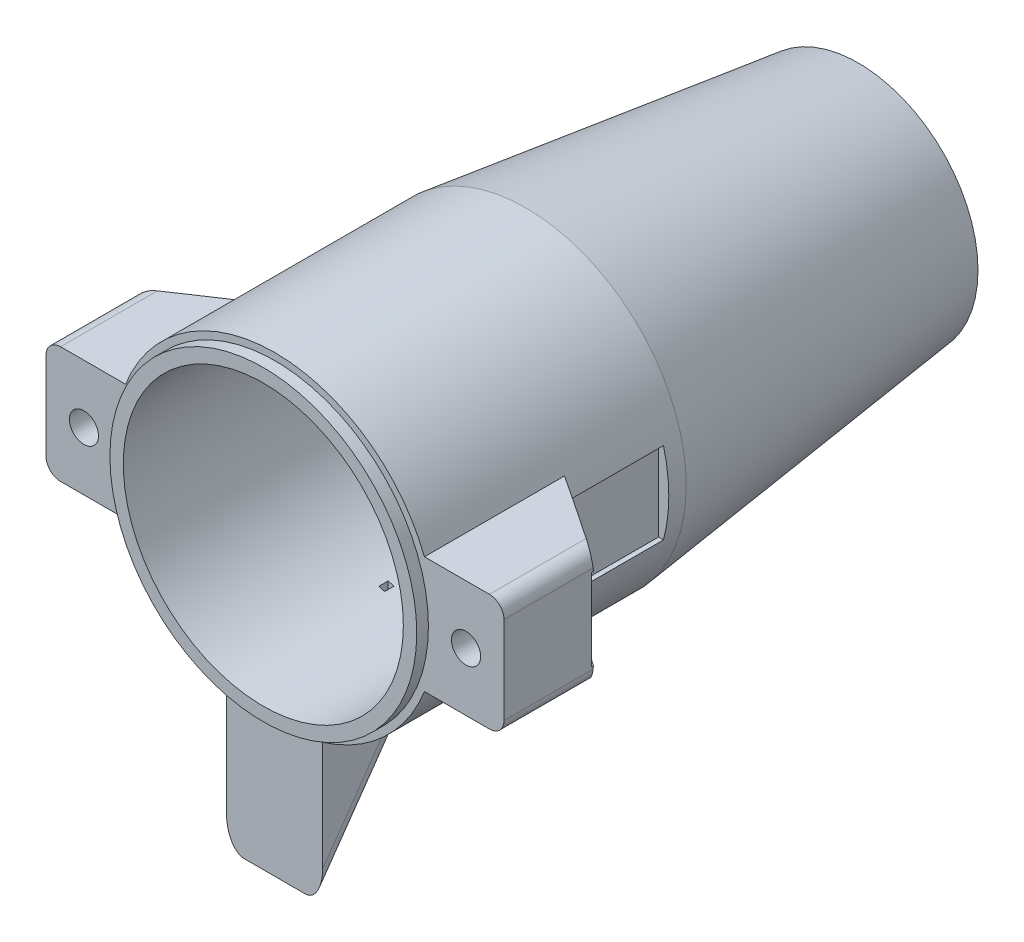
from build123d import *

# Parameters (mm, degrees)
SKETCH1_R               = 13.75
SKETCH1_R_2             = 12
BOSS_EXTRUDE1_DEPTH     = 50
SKETCH2_R               = 1.25
BOSS_EXTRUDE2_DEPTH     = 7.5
SKETCH4_R               = 13.25
BOSS_EXTRUDE3_DEPTH     = 20
SKETCH8_R               = 5.2
CUT_EXTRUDE2_DEPTH      = 20
CHAMFER2_SIZE           = 2.8
CHAMFER2_SIZE2          = 19.311263845
BOSS_EXTRUDE4_DEPTH     = 0.991311543
SKETCH9_W               = 6.2
SKETCH9_H               = 6.2
CUT_EXTRUDE3_DEPTH      = 1.2
CUT_EXTRUDE4_REACH      = 62.367
CUT_EXTRUDE4_END_RADIUS = 12
SKETCH10_W              = 0.5
SKETCH10_H              = 0.8
BOSS_EXTRUDE5_START     = 1
SKETCH11_R              = 13.15
SKETCH11_R_2            = 12
BOSS_EXTRUDE5_DEPTH     = 1
CHAMFER4_SIZE           = 1
SKETCH12_W              = 8.25
SKETCH12_H              = 12
BOSS_EXTRUDE6_DEPTH     = 8.5
CHAMFER5_SIZE           = 8.5
CHAMFER5_SIZE_2         = 12.139258057
FILLET3_R               = 1.5
SKETCH13_W              = 7
SKETCH13_H              = 7
CUT_EXTRUDE5_DEPTH      = 12.5
CHAMFER6_SIZE           = 4.5
CHAMFER6_SIZE_2         = 6.42666603
CHAMFER3_SIZE           = 3.5
CHAMFER3_SIZE2          = 28.505212498
FILLET4_R               = 1.25


with BuildPart() as part:
    # Sketch1 → Boss-Extrude1 (new body)
    with BuildSketch(Plane.XY):
        Circle(SKETCH1_R)
        Circle(SKETCH1_R_2, mode=Mode.SUBTRACT)
    extrude(amount=-BOSS_EXTRUDE1_DEPTH)

    # Sketch2 → Boss-Extrude2 (add)
    # profile 1 of 2: a face of its own
    with BuildSketch(Plane.XY):
        with BuildLine():
            ThreePointArc((-12.808688457, -5), (-13.75, 0), (-12.808688457, 5))
            Line((-12.808688457, 5), (-19.624999957, 5))
            Line((-19.624999957, 5), (-19.624999957, -5))
            Line((-19.624999957, -5), (-12.808688457, -5))
        make_face()
        with Locations((-16.375, 0)):
            Circle(SKETCH2_R, mode=Mode.SUBTRACT)
    # profile 2 of 2: a face of its own
    with BuildSketch(Plane.XY):
        with BuildLine():
            Line((19.624999957, 5), (12.808688457, 5))
            ThreePointArc((12.808688457, 5), (13.512623104, 2.54391762), (13.75, 0))
            ThreePointArc((13.75, 0), (13.512623104, -2.54391762), (12.808688457, -5))
            Line((12.808688457, -5), (19.624999957, -5))
            Line((19.624999957, -5), (19.624999957, 5))
        make_face()
        with Locations((16.375, 0)):
            Circle(SKETCH2_R, mode=Mode.SUBTRACT)
    extrude(amount=-BOSS_EXTRUDE2_DEPTH)

    # Sketch4 → Boss-Extrude3 (add)
    with BuildSketch(Plane(origin=(0, 0, -50), x_dir=(-1, 0, 0), z_dir=(0, 0, -1))):
        Circle(SKETCH4_R)
    extrude(amount=-BOSS_EXTRUDE3_DEPTH)

    # Sketch8 → Cut-Extrude2 (cut)
    with BuildSketch(Plane.XY.offset(-30)):
        Circle(SKETCH8_R)
    extrude(amount=-CUT_EXTRUDE2_DEPTH, mode=Mode.SUBTRACT)

    # Chamfer2
    chamfer2_edges = [part.edges().sort_by_distance(p)[0] for p in [
        (-5.2, 0, -30),
    ]]
    chamfer2_side = [part.faces().sort_by_distance(p)[0] for p in [
        (-11.660588745, 0, -30),
    ]]
    chamfer(chamfer2_edges, length=CHAMFER2_SIZE, length2=CHAMFER2_SIZE2, reference=chamfer2_side[0])

    # 3DSketch3 → Boss-Extrude4 (add)
    with BuildSketch(Plane(origin=(-5, -13.8, -11), x_dir=(0.7808688094430304, 0, -0.6246950475544243), z_dir=(0, -1, 0))):
        Polygon((0, 0), (7.808688094, 6.246950476), (12.806248475, 0), (4.99756038, -6.246950476), align=None)
    extrude(amount=-BOSS_EXTRUDE4_DEPTH)

    # Sketch9 → Cut-Extrude3 (cut)
    with BuildSketch(Plane.XZ.offset(13.8)):
        with Locations((0, -15)):
            Rectangle(SKETCH9_W, SKETCH9_H)
    extrude(amount=-CUT_EXTRUDE3_DEPTH, mode=Mode.SUBTRACT)

    # Cut-Extrude4: up to this cylinder (the profile starts outside it)
    cut_extrude4_end = Plane(origin=(0, 0, -15), z_dir=(0, 0, 1)) * Cylinder(CUT_EXTRUDE4_END_RADIUS, 154.234, mode=Mode.PRIVATE)
    # Sketch10 → Cut-Extrude4 (cut, up to the surface)
    with BuildSketch(Plane.XZ.offset(13.8), mode=Mode.PRIVATE) as cut_extrude4_sk1:
        with Locations((3.2, -12.75)):
            Rectangle(SKETCH10_W, SKETCH10_H)
    cut_extrude4_tool1 = extrude(cut_extrude4_sk1.sketch, amount=-CUT_EXTRUDE4_REACH, mode=Mode.PRIVATE) - cut_extrude4_end
    add(cut_extrude4_tool1.solids().sort_by_distance((3.2, -13.8, -12.75))[0], mode=Mode.SUBTRACT)
    # Sketch10 → Cut-Extrude4 (cut, up to the surface)
    with BuildSketch(Plane.XZ.offset(13.8), mode=Mode.PRIVATE) as cut_extrude4_sk2:
        with Locations((-3.2, -12.75)):
            Rectangle(SKETCH10_W, SKETCH10_H)
    cut_extrude4_tool2 = extrude(cut_extrude4_sk2.sketch, amount=-CUT_EXTRUDE4_REACH, mode=Mode.PRIVATE) - cut_extrude4_end
    add(cut_extrude4_tool2.solids().sort_by_distance((-3.2, -13.8, -12.75))[0], mode=Mode.SUBTRACT)
    # Sketch10 → Cut-Extrude4 (cut, up to the surface)
    with BuildSketch(Plane.XZ.offset(13.8), mode=Mode.PRIVATE) as cut_extrude4_sk3:
        with Locations((3.2, -17.25)):
            Rectangle(SKETCH10_W, SKETCH10_H)
    cut_extrude4_tool3 = extrude(cut_extrude4_sk3.sketch, amount=-CUT_EXTRUDE4_REACH, mode=Mode.PRIVATE) - cut_extrude4_end
    add(cut_extrude4_tool3.solids().sort_by_distance((3.2, -13.8, -17.25))[0], mode=Mode.SUBTRACT)
    # Sketch10 → Cut-Extrude4 (cut, up to the surface)
    with BuildSketch(Plane.XZ.offset(13.8), mode=Mode.PRIVATE) as cut_extrude4_sk4:
        with Locations((-3.2, -17.25)):
            Rectangle(SKETCH10_W, SKETCH10_H)
    cut_extrude4_tool4 = extrude(cut_extrude4_sk4.sketch, amount=-CUT_EXTRUDE4_REACH, mode=Mode.PRIVATE) - cut_extrude4_end
    add(cut_extrude4_tool4.solids().sort_by_distance((-3.2, -13.8, -17.25))[0], mode=Mode.SUBTRACT)

    # Sketch11 → Boss-Extrude5 (add)
    with BuildSketch(Plane.XY.offset(BOSS_EXTRUDE5_START)):
        Circle(SKETCH11_R)
        Circle(SKETCH11_R_2, mode=Mode.SUBTRACT)
    extrude(amount=-BOSS_EXTRUDE5_DEPTH)

    # Chamfer4
    # the kernel refuses this chamfer: 1 mm, written as the material it takes off along each edge
    with BuildSketch(Plane(origin=(-5, -13.8, -21.571682988), x_dir=(0.9996219169112968, -0.027495876610585647, 0), z_dir=(0, 0, 1))) as chamfer4_piece_1_section:
        Polygon((CHAMFER4_SIZE * 0.999621916911, CHAMFER4_SIZE * 0.0274958766106), (-CHAMFER4_SIZE * 0.0274958766106, CHAMFER4_SIZE * 0.999621916911), (0, 0), align=None)
    chamfer4_piece_1 = extrude(amount=13.143365976, mode=Mode.PRIVATE)
    chamfer4_piece_1 = chamfer4_piece_1 - Plane(origin=(0, 0, -15), x_dir=(1, 0, 0), z_dir=(0, 0, 1)) * Cylinder(13.75, 31, mode=Mode.PRIVATE)
    add(chamfer4_piece_1, mode=Mode.SUBTRACT)
    with BuildSketch(Plane(origin=(5, -13.8, -8.428317012), x_dir=(0.02749587661058651, 0.9996219169112968, 0), z_dir=(0, 0, -1))) as chamfer4_piece_2_section:
        Polygon((CHAMFER4_SIZE * 0.999621916911, -CHAMFER4_SIZE * 0.0274958766106), (-CHAMFER4_SIZE * 0.0274958766106, -CHAMFER4_SIZE * 0.999621916911), (0, 0), align=None)
    chamfer4_piece_2 = extrude(amount=13.143365976, mode=Mode.PRIVATE)
    chamfer4_piece_2 = chamfer4_piece_2 - Plane(origin=(0, 0, -15), x_dir=(1, 0, 0), z_dir=(0, 0, 1)) * Cylinder(13.75, 31, mode=Mode.PRIVATE)
    add(chamfer4_piece_2, mode=Mode.SUBTRACT)

    # Sketch12 → Boss-Extrude6 (add)
    with BuildSketch(Plane.XY):
        with Locations((-0.036830357, -19.128189859)):
            Rectangle(SKETCH12_W, SKETCH12_H)
    extrude(amount=-BOSS_EXTRUDE6_DEPTH)

    # Chamfer5
    # the kernel refuses this chamfer: 12.139258057, 8.5 mm, written as the material it takes off along each edge
    with BuildSketch(Plane(origin=(-35.512098327, -25.128189859, -8.5), x_dir=(0, -0.045263737714021236, 0.9989750717851554), z_dir=(1, 0, 0))) as chamfer5_piece_1_section:
        Polygon((CHAMFER5_SIZE * 0.998975071785, -CHAMFER5_SIZE * 0.045263737714), (-CHAMFER5_SIZE_2 * 0.0452637377152, -CHAMFER5_SIZE_2 * 0.998975071811), (0, 0), align=None)
    chamfer5_piece_1 = extrude(amount=70.95053594, mode=Mode.PRIVATE)
    chamfer5_piece_1 = chamfer5_piece_1 - Plane(origin=(0, 0, -5.73810834), x_dir=(1, 0, 0), z_dir=(0, 0, 1)) * Cylinder(13.75, 191, mode=Mode.PRIVATE)
    add(chamfer5_piece_1, mode=Mode.SUBTRACT)

    # Fillet3
    fillet3_edges = [part.edges().sort_by_distance(p)[0] for p in [
        (-4.161830357, -19.128189859, -4.201245229),
        (4.088169643, -19.128189859, -4.201245229),
    ]]
    fillet(fillet3_edges, radius=FILLET3_R)

    # Sketch13 → Cut-Extrude5 (cut)
    with BuildSketch(Plane(origin=(0, 0, -7.5), x_dir=(-1, 0, 0), z_dir=(0, 0, -1))):
        with Locations((-16.375, 0)):
            Rectangle(SKETCH13_W, SKETCH13_H)
        with Locations((16.375, 0)):
            Rectangle(SKETCH13_W, SKETCH13_H)
    extrude(amount=CUT_EXTRUDE5_DEPTH, mode=Mode.SUBTRACT)

    # Chamfer6
    # the kernel refuses this chamfer: 6.42666603, 4.5 mm, written as the material it adds along each edge
    with BuildSketch(Plane(origin=(0, 0, -7.5), x_dir=(-0.008443836697967595, 0.999964350175454, 0), z_dir=(-0.999964350175454, -0.008443836697967595, 0))) as chamfer6_piece_1_section:
        Polygon((13.75, CHAMFER6_SIZE), (13.75 + CHAMFER6_SIZE_2, 0), (13.75, 0), align=None)
    chamfer6_piece_1 = revolve(axis=Axis((0, 0, -7.5), (0, 0, -1)), revolution_arc=144.897264771, mode=Mode.PRIVATE)
    chamfer6_piece_1 = split(chamfer6_piece_1, bisect_by=Plane(origin=(15.287184037, 5, -9.004359876), z_dir=(0, -1, 0)), keep=Keep.TOP, mode=Mode.PRIVATE)
    chamfer6_piece_1 = split(chamfer6_piece_1, bisect_by=Plane(origin=(19.624999957, 4.253690529, -9.004359876), z_dir=(-1, 0, 0)), keep=Keep.TOP, mode=Mode.PRIVATE)
    chamfer6_piece_1 = split(chamfer6_piece_1, bisect_by=Plane(origin=(15.287184037, 3.5, -9.004359876), z_dir=(0, 1, 0)), keep=Keep.TOP, mode=Mode.PRIVATE)
    add(chamfer6_piece_1)
    with BuildSketch(Plane(origin=(0, 0, -7.5), x_dir=(-0.008443836697967595, 0.999964350175454, 0), z_dir=(-0.999964350175454, -0.008443836697967595, 0))) as chamfer6_piece_2_section:
        Polygon((13.75, CHAMFER6_SIZE), (13.75 + CHAMFER6_SIZE_2, 0), (13.75, 0), align=None)
    chamfer6_piece_2 = revolve(axis=Axis((0, 0, -7.5), (0, 0, -1)), revolution_arc=144.897264771, mode=Mode.PRIVATE)
    chamfer6_piece_2 = split(chamfer6_piece_2, bisect_by=Plane(origin=(19.624999957, -4.253690529, -9.004359876), z_dir=(-1, 0, 0)), keep=Keep.TOP, mode=Mode.PRIVATE)
    chamfer6_piece_2 = split(chamfer6_piece_2, bisect_by=Plane(origin=(15.287184037, -3.5, -9.004359876), z_dir=(0, -1, 0)), keep=Keep.TOP, mode=Mode.PRIVATE)
    chamfer6_piece_2 = split(chamfer6_piece_2, bisect_by=Plane(origin=(15.287184037, -5, -9.004359876), z_dir=(0, 1, 0)), keep=Keep.TOP, mode=Mode.PRIVATE)
    add(chamfer6_piece_2)
    with BuildSketch(Plane(origin=(0, 0, -7.5), x_dir=(0.008443836697964339, -0.999964350175454, 0), z_dir=(0.999964350175454, 0.008443836697964339, 0))) as chamfer6_piece_3_section:
        Polygon((13.75, CHAMFER6_SIZE), (13.75 + CHAMFER6_SIZE_2, 0), (13.75, 0), align=None)
    chamfer6_piece_3 = revolve(axis=Axis((0, 0, -7.5), (0, 0, -1)), revolution_arc=144.897264771, mode=Mode.PRIVATE)
    chamfer6_piece_3 = split(chamfer6_piece_3, bisect_by=Plane(origin=(-12.906482524, -5, -11.926294402), z_dir=(0, 1, 0)), keep=Keep.TOP, mode=Mode.PRIVATE)
    chamfer6_piece_3 = split(chamfer6_piece_3, bisect_by=Plane(origin=(-19.624999957, -4.934370219, -11.926294402), z_dir=(1, 0, 0)), keep=Keep.TOP, mode=Mode.PRIVATE)
    chamfer6_piece_3 = split(chamfer6_piece_3, bisect_by=Plane(origin=(-12.906482524, -3.5, -11.926294402), z_dir=(0, -1, 0)), keep=Keep.TOP, mode=Mode.PRIVATE)
    add(chamfer6_piece_3)
    with BuildSketch(Plane(origin=(0, 0, -7.5), x_dir=(0.008443836697964339, -0.999964350175454, 0), z_dir=(0.999964350175454, 0.008443836697964339, 0))) as chamfer6_piece_4_section:
        Polygon((13.75, CHAMFER6_SIZE), (13.75 + CHAMFER6_SIZE_2, 0), (13.75, 0), align=None)
    chamfer6_piece_4 = revolve(axis=Axis((0, 0, -7.5), (0, 0, -1)), revolution_arc=144.897264771, mode=Mode.PRIVATE)
    chamfer6_piece_4 = split(chamfer6_piece_4, bisect_by=Plane(origin=(-19.624999957, 4.25463743, -11.933336397), z_dir=(1, 0, 0)), keep=Keep.TOP, mode=Mode.PRIVATE)
    chamfer6_piece_4 = split(chamfer6_piece_4, bisect_by=Plane(origin=(-13.117325859, 3.5, -11.933336397), z_dir=(0, 1, 0)), keep=Keep.TOP, mode=Mode.PRIVATE)
    chamfer6_piece_4 = split(chamfer6_piece_4, bisect_by=Plane(origin=(-13.117325859, 5, -11.933336397), z_dir=(0, -1, 0)), keep=Keep.TOP, mode=Mode.PRIVATE)
    add(chamfer6_piece_4)

    # Chamfer3
    chamfer3_edges = [part.edges().sort_by_distance(p)[0] for p in [
        (-13.75, 0, -50),
    ]]
    chamfer3_side = [part.faces().sort_by_distance(p)[0] for p in [
        (-13.36109127, 0, -50),
    ]]
    chamfer(chamfer3_edges, length=CHAMFER3_SIZE, length2=CHAMFER3_SIZE2, reference=chamfer3_side[0])

    # Fillet4
    fillet4_edges = [part.edges().sort_by_distance(p)[0] for p in [
        (-19.624999957, -5, -3.75),
        (-19.624999957, 5, -3.75),
        (19.624999957, 5, -3.75),
        (19.624999957, -5, -3.75),
    ]]
    fillet(fillet4_edges, radius=FILLET4_R)


solid = part.part
